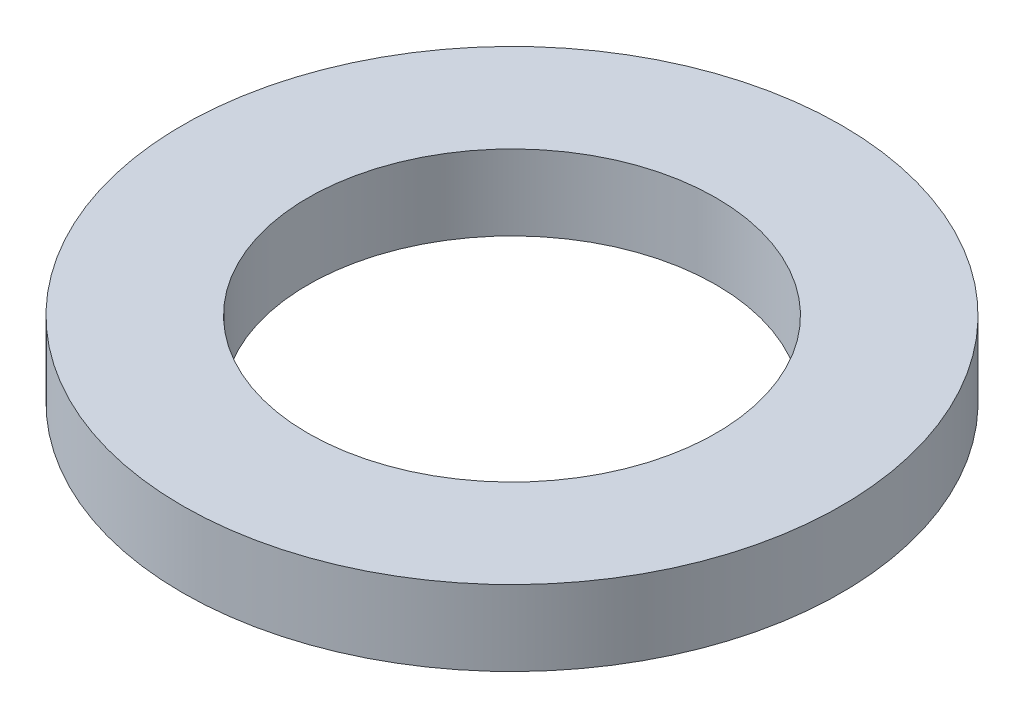
from build123d import *

# Parameters (mm, degrees)
SKETCH1_R           = 52.5
BOSS_EXTRUDE1_DEPTH = 12
SKETCH2_R           = 32.5
CUT_EXTRUDE1_DEPTH  = 76.20970682


with BuildPart() as part:
    # Sketch1 → Boss-Extrude1 (new body)
    with BuildSketch(Plane(origin=(0, 0, 0), x_dir=(1, 0, 0), z_dir=(0, 1, 0))):
        Circle(SKETCH1_R)
    extrude(amount=BOSS_EXTRUDE1_DEPTH)

    # Sketch2 → Cut-Extrude1 (cut, through all)
    with BuildSketch(Plane(origin=(0, 0, 0), x_dir=(1, 0, 0), z_dir=(0, 1, 0))):
        Circle(SKETCH2_R)
    extrude(amount=CUT_EXTRUDE1_DEPTH, mode=Mode.SUBTRACT)


solid = part.part
